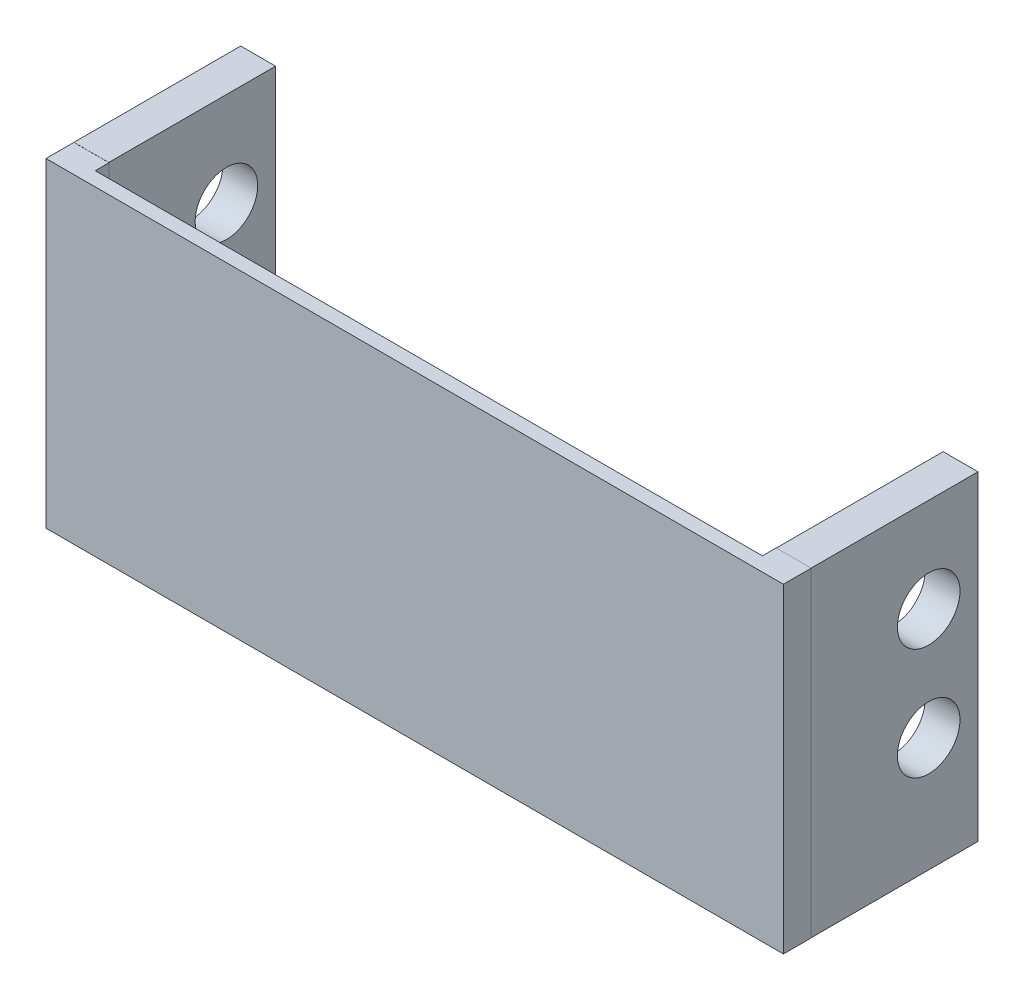
from build123d import *

# Parameters (mm, degrees)
BOSS_EXTRUDE3_DEPTH       = 10
BOSS_EXTRUDE3_DEPTH_BACK  = 13.014944575
SKETCH1_W                 = 53
SKETCH1_H                 = 2
SKETCH2_W                 = 2.504977783
SKETCH2_H                 = 23.010208786
BOSS_EXTRUDE4_DEPTH       = 12
SKETCH3_W                 = 2.506556419
SKETCH3_H                 = 23.01450768
BOSS_EXTRUDE5_DEPTH       = 11.990007083
BOSS_EXTRUDE6_START       = -52.981944033
BOSS_EXTRUDE6_OUTLINE_R   = 2.248774255
BOSS_EXTRUDE6_OUTLINE_R_2 = 2.25
BOSS_EXTRUDE6_DEPTH       = 52.981944033
SKETCH6_W                 = 47.946959802
SKETCH6_H                 = 0.996975491
CUT_EXTRUDE2_DEPTH        = 29


# Read off the part's stored shape, not the designer's step: Boss-Extrude6
with BuildPart() as part:
    # Sketch1 → Boss-Extrude3 (new, two sides: drawn at the far end of the back side and taken through both)
    with BuildSketch(Plane(origin=(0, 0, 0), x_dir=(1, 0, 0), z_dir=(0, 1, 0)).offset(-BOSS_EXTRUDE3_DEPTH_BACK)):
        with Locations((-23.514130948, 2.769901189)):
            Rectangle(SKETCH1_W, SKETCH1_H)
    extrude(amount=BOSS_EXTRUDE3_DEPTH + BOSS_EXTRUDE3_DEPTH_BACK)

    # Sketch2 → Boss-Extrude4 (add)
    with BuildSketch(Plane(origin=(-2.522360337, 0, -3.769901189), x_dir=(-1, 0, 0), z_dir=(0, 0, -1))):
        with Locations((-4.240718342, -1.512860106)):
            Rectangle(SKETCH2_W, SKETCH2_H)
    extrude(amount=BOSS_EXTRUDE4_DEPTH)

    # Sketch3 → Boss-Extrude5 (add)
    with BuildSketch(Plane(origin=(0, 0, -3.769901189), x_dir=(-1, 0, 0), z_dir=(0, 0, -1))):
        with Locations((48.757818929, -1.500170116)):
            Rectangle(SKETCH3_W, SKETCH3_H)
    extrude(amount=BOSS_EXTRUDE5_DEPTH)

    # Boss-Extrude6 outline → Boss-Extrude6 (cut)
    with BuildSketch(Plane(origin=(2.970846895, 0, 0), x_dir=(0, 0, -1), z_dir=(1, 0, 0)).offset(BOSS_EXTRUDE6_START)):
        with Locations((12.226476123, 3.226243709)):
            Circle(BOSS_EXTRUDE6_OUTLINE_R)
        with Locations((12.224283194, -4.788420336)):
            Circle(BOSS_EXTRUDE6_OUTLINE_R_2)
    extrude(amount=BOSS_EXTRUDE6_DEPTH, mode=Mode.SUBTRACT)

    # Sketch6 → Cut-Extrude2 (cut)
    with BuildSketch(Plane(origin=(0, -13.014944575, 0), x_dir=(-1, 0, 0), z_dir=(0, -1, 0))):
        with Locations((23.509982369, 3.279148845)):
            Rectangle(SKETCH6_W, SKETCH6_H)
    extrude(amount=-CUT_EXTRUDE2_DEPTH, mode=Mode.SUBTRACT)


solid = part.part
